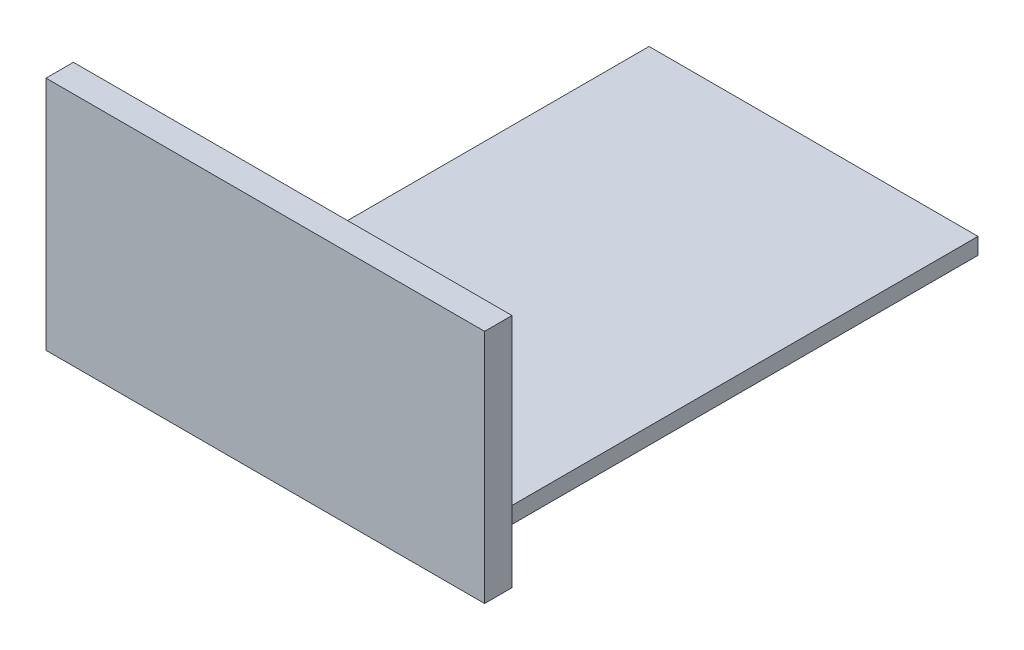
from build123d import *

# Parameters (mm, degrees)
SKETCH_1_W           = 60
SKETCH_1_H           = 100
EXTRUDE_1_DEPTH      = 3
EXTRUDE_2_DEPTH      = 40
EXTRUDE_2_DEPTH_BACK = 3
SKETCH_2_W           = 80
SKETCH_2_H           = 5
FILLET_1_R           = 10


with BuildPart() as part:
    # Эскиз1 → Бобышка-Вытянуть1 (new body)
    with BuildSketch(Plane(origin=(0, 0, 0), x_dir=(1, 0, 0), z_dir=(0, 1, 0))):
        Rectangle(SKETCH_1_W, SKETCH_1_H)
    extrude(amount=EXTRUDE_1_DEPTH)

    # Эскиз2 → Бобышка-Вытянуть2 (add, two sides: drawn at the far end of the back side and taken through both)
    with BuildSketch(Plane(origin=(0, 3, 0), x_dir=(1, 0, 0), z_dir=(0, 1, 0)).offset(-EXTRUDE_2_DEPTH_BACK)):
        with Locations((0, -47.5)):
            Rectangle(SKETCH_2_W, SKETCH_2_H)
    extrude(amount=EXTRUDE_2_DEPTH + EXTRUDE_2_DEPTH_BACK)

    # Скругление1
    fillet_1_edges = [part.edges().sort_by_distance(p)[0] for p in [
        (30, 1.5, 45),
        (-30, 1.5, 45),
    ]]
    fillet(fillet_1_edges, radius=FILLET_1_R - 0.0001)  # a hair under: the kernel refuses the full size


solid = part.part
